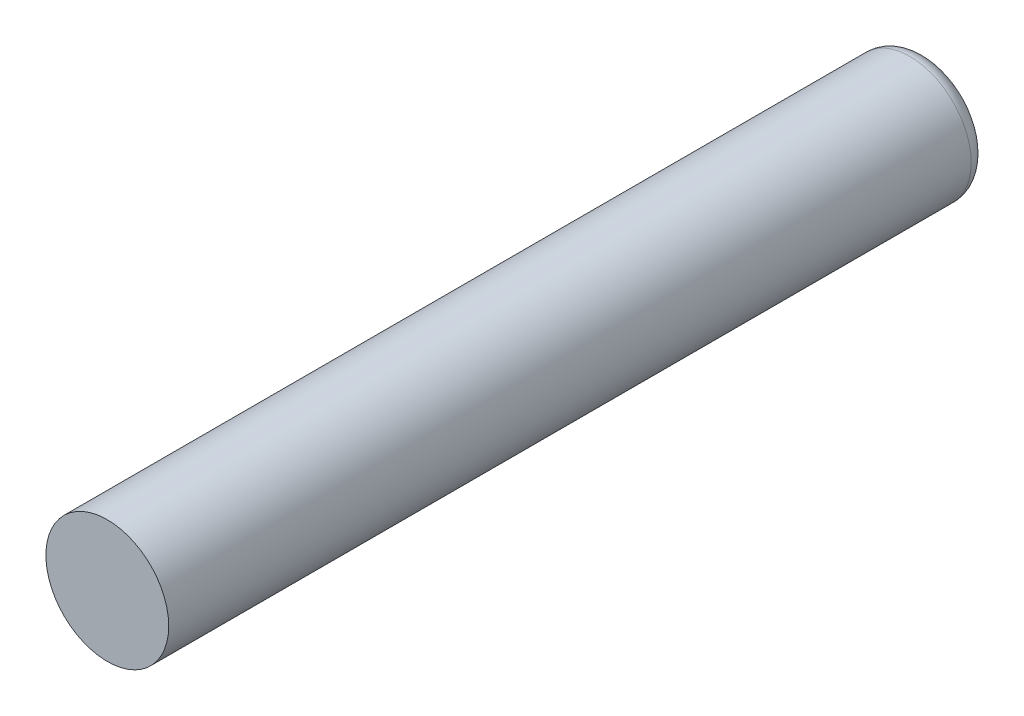
from build123d import *

# Parameters (mm, degrees)
SZKIC1_R                    = 15
DODANIE_WYCI_GNI_CIE1_DEPTH = 200
ZAOKR_GLENIE1_R             = 4


with BuildPart() as part:
    # Szkic1 → Dodanie-wyciągnięcie1 (new body)
    with BuildSketch(Plane.XY):
        Circle(SZKIC1_R)
    extrude(amount=DODANIE_WYCI_GNI_CIE1_DEPTH)

    # Zaokrąglenie1
    zaokr_glenie1_edges = [part.edges().sort_by_distance(p)[0] for p in [
        (-15, 0, 0),
    ]]
    fillet(zaokr_glenie1_edges, radius=ZAOKR_GLENIE1_R)


solid = part.part
